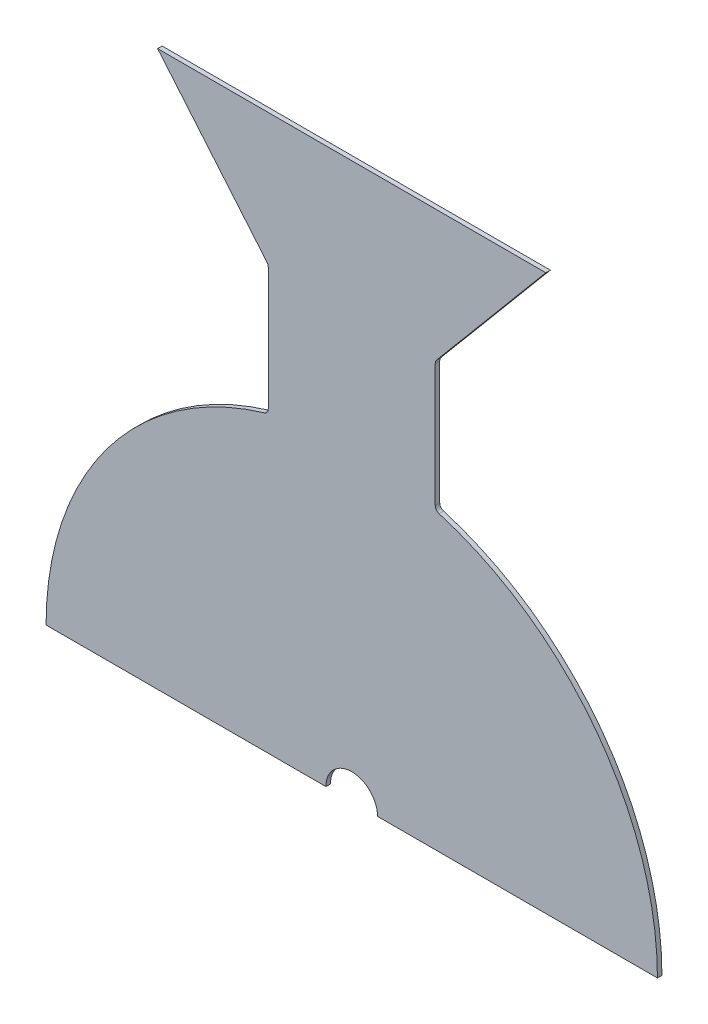
from build123d import *

# Parameters (mm, degrees)
BASE_FLANGE1_DEPTH = 2.65684
FILLET1_R          = 3.175


# Sheet-metal steps are written as plain solids
with BuildPart() as part:
    # Sketch1 → Base-Flange1 (new body)
    with BuildSketch(Plane.XY):
        with BuildLine():
            Line((-180.45684, 0), (-15.24, 0))
            ThreePointArc((-15.24, 0), (0, 15.24), (15.24, 0))
            Line((15.24, 0), (180.45684, 0))
            ThreePointArc((180.45684, 0), (143.97849234, 108.788165011), (49.29124, 173.594483674))
            Line((49.29124, 173.594483674), (49.29124, 249.794483674))
            Line((49.29124, 249.794483674), (114.598461144, 327.624599095))
            Line((114.598461144, 327.624599095), (-114.598461144, 327.624599095))
            Line((-114.598461144, 327.624599095), (-49.29124, 249.794483674))
            Line((-49.29124, 249.794483674), (-49.29124, 173.594483674))
            ThreePointArc((-49.29124, 173.594483674), (-143.97849234, 108.788165011), (-180.45684, 0))
        make_face()
    extrude(amount=-BASE_FLANGE1_DEPTH)

    # Fillet1
    fillet1_edges = [part.edges().sort_by_distance(p)[0] for p in [
        (-49.29124, 173.594483674, -1.32842),
        (-49.29124, 249.794483674, -1.32842),
        (49.29124, 249.794483674, -1.32842),
        (49.29124, 173.594483674, -1.32842),
    ]]
    fillet(fillet1_edges, radius=FILLET1_R)


solid = part.part
